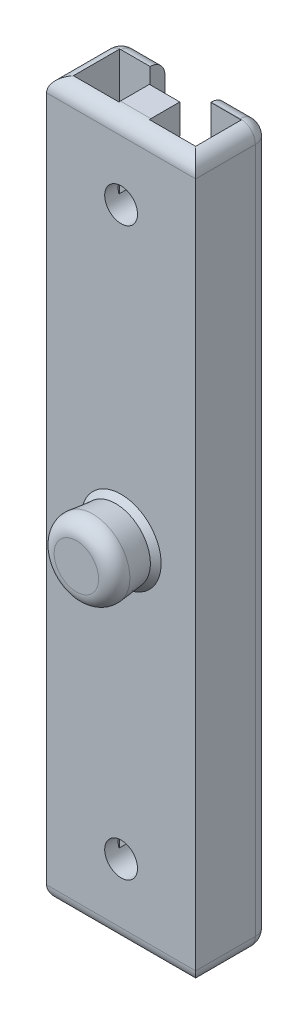
from build123d import *

# Parameters (mm, degrees)
SKETCH1_W           = 25
SKETCH1_H           = 25
BOSS_EXTRUDE1_DEPTH = 120
CUT_EXTRUDE1_DEPTH  = 120
SKETCH3_W           = 25
SKETCH3_H           = 12.5
CUT_EXTRUDE2_DEPTH  = 120
FILLET1_R           = 2.5
FILLET2_R           = 2.5
FILLET3_R           = 2.5
SKETCH6_R           = 2.75
CUT_EXTRUDE3_DEPTH  = 10
SKETCH7_W           = 10.05
SKETCH7_H           = 15.1
CUT_EXTRUDE4_DEPTH  = 2.5
SKETCH9_R           = 6.5
BOSS_EXTRUDE3_DEPTH = 7.5
BOSS_EXTRUDE3_DRAFT = -6
FILLET4_R           = 2.5
CHAMFER1_SIZE       = 1
CHAMFER1_SIZE2      = 0.909876415


with BuildPart() as part:
    # Sketch1 → Boss-Extrude1 (new body)
    with BuildSketch(Plane(origin=(0, 0, 0), x_dir=(1, 0, 0), z_dir=(0, 1, 0))):
        Rectangle(SKETCH1_W, SKETCH1_H)
    extrude(amount=BOSS_EXTRUDE1_DEPTH)

    # Sketch2 → Cut-Extrude1 (cut)
    with BuildSketch(Plane(origin=(0, 120, 0), x_dir=(1, 0, 0), z_dir=(0, 1, 0))):
        Polygon((-10.25, -2.48824277), (-10.25, -10.25), (-2.61175723, -10.25), (-2.61175723, -5.15), (2.48824277, -5.15), (2.48824277, -10.25), (10.25, -10.25), (10.25, -2.61175723), (5.15, -2.61175723), (5.15, 2.48824277), (10.25, 2.48824277), (10.25, 10.25), (2.61175723, 10.25), (2.61175723, 5.15), (-2.48824277, 5.15), (-2.48824277, 10.25), (-10.25, 10.25), (-10.25, 2.61175723), (-5.15, 2.61175723), (-5.15, -2.48824277), align=None)
    extrude(amount=-CUT_EXTRUDE1_DEPTH, mode=Mode.SUBTRACT)

    # Sketch3 → Cut-Extrude2 (cut)
    with BuildSketch(Plane(origin=(0, 120, 0), x_dir=(1, 0, 0), z_dir=(0, 1, 0))):
        with Locations((0, 6.25)):
            Rectangle(SKETCH3_W, SKETCH3_H)
    extrude(amount=-CUT_EXTRUDE2_DEPTH, mode=Mode.SUBTRACT)

    # Fillet1
    fillet1_edges = [part.edges().sort_by_distance(p)[0] for p in [
        (-12.5, 60, 0),
    ]]
    fillet(fillet1_edges, radius=FILLET1_R)

    # Fillet2
    fillet2_edges = [part.edges().sort_by_distance(p)[0] for p in [
        (12.5, 60, 0),
    ]]
    fillet(fillet2_edges, radius=FILLET2_R)

    # Fillet3
    # the kernel refuses this fillet: 2.5 mm, written as the material it takes off along each edge
    with BuildSketch(Plane(origin=(-10, 0, 0), x_dir=(0, 0, 1), z_dir=(1, 0, 0)), Plane(origin=(-1.1, 0, 0), x_dir=(0, 0, 1), z_dir=(1, 0, 0)), Plane(origin=(-10, 120, 0), x_dir=(0, -1, 0), z_dir=(1, 0, 0)), Plane(origin=(-1.1, 120, 0), x_dir=(0, -1, 0), z_dir=(1, 0, 0))) as fillet3_piece_1:
        with BuildLine():
            CenterArc((FILLET3_R, -FILLET3_R), FILLET3_R, 90, 90)
            Line((0, -FILLET3_R), (0, 0))
            Line((0, 0), (FILLET3_R, 0))
        make_face()
    extrude(amount=11.1, mode=Mode.SUBTRACT)
    with BuildSketch(Plane(origin=(-10, 0, 2.5), x_dir=(-1, 0, 0), z_dir=(0, 0, 1))) as fillet3_piece_2:
        with BuildLine():
            CenterArc((2.5 - FILLET3_R, -FILLET3_R), FILLET3_R, 0, 90)
            Line((2.5, -FILLET3_R), (2.5, 0))
            Line((2.5, 0), (2.5 - FILLET3_R, 0))
        make_face()
    revolve(axis=Axis((-10, 0, 2.5), (0, -1, 0)), revolution_arc=90, mode=Mode.SUBTRACT)
    with BuildSketch(Plane(origin=(10, 0, 2.5), x_dir=(1, 0, 0), z_dir=(0, 0, 1))) as fillet3_piece_3:
        with BuildLine():
            CenterArc((2.5 - FILLET3_R, FILLET3_R), FILLET3_R, 270, 90)
            Line((2.5, FILLET3_R), (2.5, 0))
            Line((2.5, 0), (2.5 - FILLET3_R, 0))
        make_face()
    revolve(axis=Axis((10, 0, 2.5), (0, 1, 0)), revolution_arc=90, mode=Mode.SUBTRACT)
    with BuildSketch(Plane(origin=(-10, 120, 2.5), x_dir=(-1, 0, 0), z_dir=(0, 0, 1))) as fillet3_piece_4:
        with BuildLine():
            CenterArc((2.5 - FILLET3_R, FILLET3_R), FILLET3_R, 270, 90)
            Line((2.5 - FILLET3_R, 0), (2.5, 0))
            Line((2.5, 0), (2.5, FILLET3_R))
        make_face()
    revolve(axis=Axis((-10, 120, 2.5), (0, -1, 0)), revolution_arc=90, mode=Mode.SUBTRACT)
    with BuildSketch(Plane(origin=(10, 120, 2.5), x_dir=(1, 0, 0), z_dir=(0, 0, 1))) as fillet3_piece_5:
        with BuildLine():
            CenterArc((2.5 - FILLET3_R, -FILLET3_R), FILLET3_R, 0, 90)
            Line((2.5 - FILLET3_R, 0), (2.5, 0))
            Line((2.5, 0), (2.5, -FILLET3_R))
        make_face()
    revolve(axis=Axis((10, 120, 2.5), (0, 1, 0)), revolution_arc=90, mode=Mode.SUBTRACT)
    with BuildSketch(Plane(origin=(-18.75, 0, 12.5), x_dir=(0, 0, -1), z_dir=(1, 0, 0)), Plane(origin=(-18.75, 120, 12.5), x_dir=(0, -1, 0), z_dir=(1, 0, 0))) as fillet3_piece_6:
        with BuildLine():
            CenterArc((FILLET3_R, FILLET3_R), FILLET3_R, 180, 90)
            Line((0, FILLET3_R), (0, 0))
            Line((0, 0), (FILLET3_R, 0))
        make_face()
    extrude(amount=37.5, mode=Mode.SUBTRACT)
    with BuildSketch(Plane(origin=(-12.5, 0, 2.5), x_dir=(1, 0, 0), z_dir=(0, 0, 1)), Plane(origin=(12.5, 0, 18.75), x_dir=(-1, 0, 0), z_dir=(0, 0, -1)), Plane(origin=(-12.5, 120, 2.5), x_dir=(0, -1, 0), z_dir=(0, 0, 1)), Plane(origin=(12.5, 120, 18.75), x_dir=(0, -1, 0), z_dir=(0, 0, -1))) as fillet3_piece_7:
        with BuildLine():
            CenterArc((FILLET3_R, FILLET3_R), FILLET3_R, 180, 90)
            Line((0, FILLET3_R), (0, 0))
            Line((0, 0), (FILLET3_R, 0))
        make_face()
    extrude(amount=16.25, mode=Mode.SUBTRACT)

    # Sketch6 → Cut-Extrude3 (cut)
    with BuildSketch(Plane.XY.offset(12.5)):
        with Locations((0, 107.5)):
            Circle(SKETCH6_R)
        with Locations((0, 12.5)):
            Circle(SKETCH6_R)
    extrude(amount=-CUT_EXTRUDE3_DEPTH, mode=Mode.SUBTRACT)

    # Sketch7 → Cut-Extrude4 (cut)
    with BuildSketch(Plane(origin=(0, 0, 5.15), x_dir=(-1, 0, 0), z_dir=(0, 0, -1))):
        with Locations((0, 107.5)):
            Rectangle(SKETCH7_W, SKETCH7_H)
        with Locations((0, 12.5)):
            Rectangle(SKETCH7_W, SKETCH7_H)
    extrude(amount=-CUT_EXTRUDE4_DEPTH, mode=Mode.SUBTRACT)


with BuildPart() as boss_extrude3_tool:
    # Sketch9 → Boss-Extrude3 (with draft: the straight prism first)
    with BuildSketch(Plane.XY.offset(20)):
        with Locations((0, 58.75)):
            Circle(SKETCH9_R)
    extrude(amount=-BOSS_EXTRUDE3_DEPTH)
    # Boss-Extrude3: the draft: its side faces are tilted about the plane it starts from
    boss_extrude3_sides = [boss_extrude3_tool.faces().sort_by_distance(p)[0] for p in [
        (-6.5, 58.75, 16.25),
    ]]
    draft(boss_extrude3_sides, Plane.XY.offset(20), BOSS_EXTRUDE3_DRAFT)


with BuildPart() as part_1:
    add(part.part)

    # Boss-Extrude3: add boss_extrude3_tool
    add(boss_extrude3_tool.part)

    # Fillet4
    fillet4_edges = [part_1.edges().sort_by_distance(p)[0] for p in [
        (-6.5, 58.75, 20),
    ]]
    fillet(fillet4_edges, radius=FILLET4_R)

    # Chamfer1
    chamfer1_edges = [part_1.edges().sort_by_distance(p)[0] for p in [
        (-5.711718236, 58.75, 12.5),
    ]]
    chamfer1_side = [part_1.faces().sort_by_distance(p)[0] for p in [
        (0, 3.67686023, 12.5),
    ]]
    chamfer(chamfer1_edges, length=CHAMFER1_SIZE, length2=CHAMFER1_SIZE2, reference=chamfer1_side[0])


solid = part_1.part
